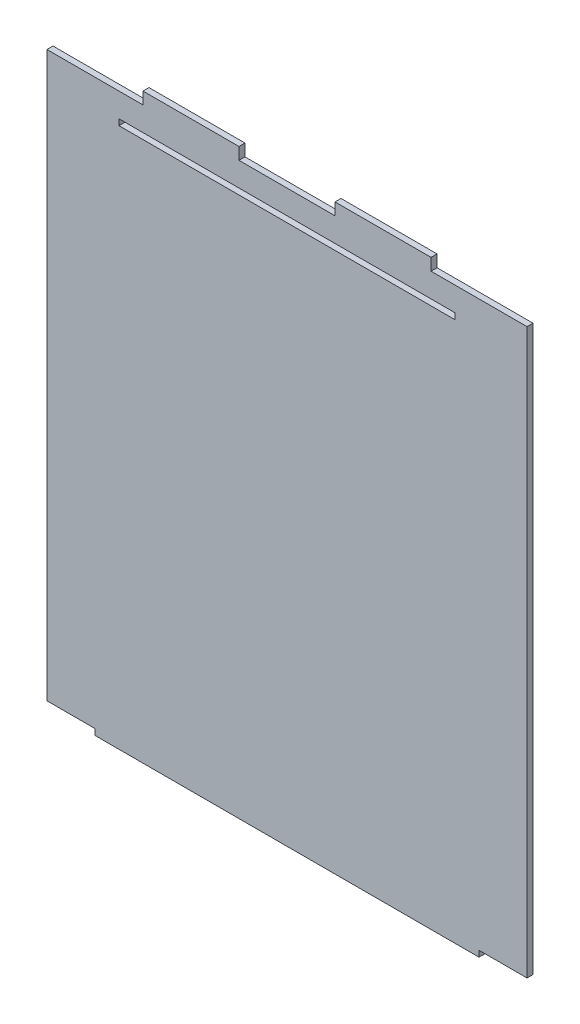
from build123d import *

# Parameters (mm, degrees)
SKETCH1_W           = 177.8
SKETCH1_H           = 3.175
BOSS_EXTRUDE1_DEPTH = 3.175


with BuildPart() as part:
    # Sketch1 → Boss-Extrude1 (new body)
    with BuildSketch(Plane.XY):
        Polygon((0, 301.625), (0, 3.175), (25.4, 3.175), (25.4, 0), (228.6, 0), (228.6, 3.175), (254, 3.175), (254, 301.625), (203.2, 301.625), (203.2, 307.975), (152.4, 307.975), (152.4, 301.625), (101.6, 301.625), (101.6, 307.975), (50.8, 307.975), (50.8, 301.625), align=None)
        with Locations((127, 287.3375)):
            Rectangle(SKETCH1_W, SKETCH1_H, mode=Mode.SUBTRACT)
    extrude(amount=BOSS_EXTRUDE1_DEPTH)


solid = part.part
